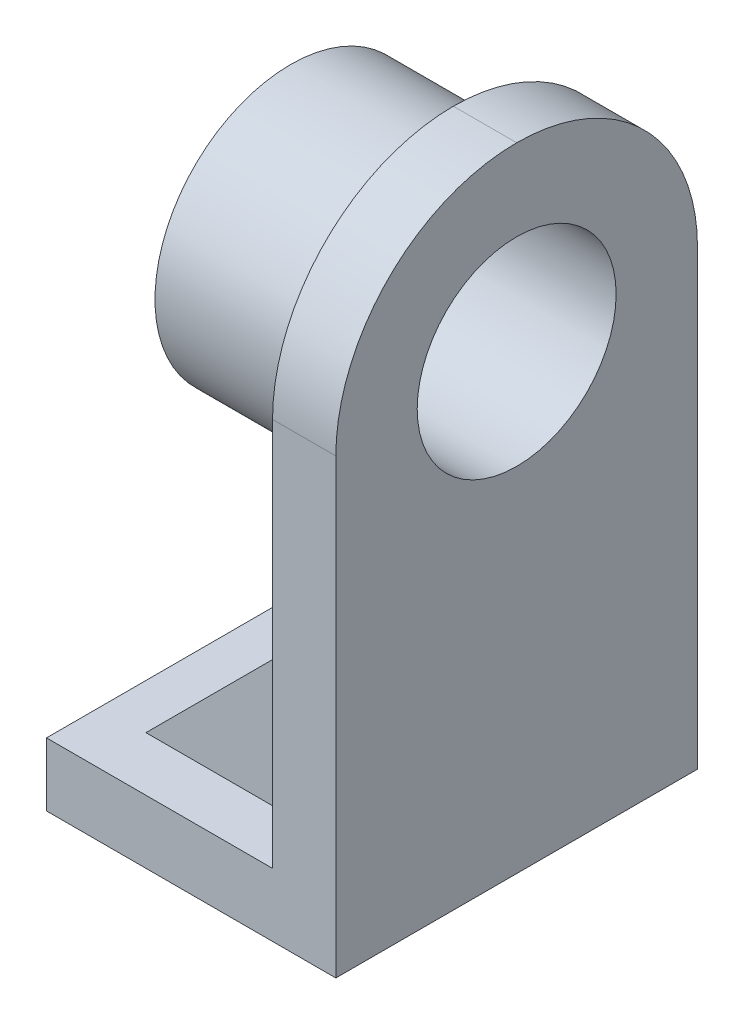
from build123d import *

# Parameters (mm, degrees)
BOSS_EXTRUDE1_DEPTH = 40
FILLET1_R           = 20
BOSS_EXTRUDE2_DEPTH = 10
CUT_EXTRUDE1_DEPTH  = 6
BOSS_EXTRUDE3_DEPTH = 10
CUT_EXTRUDE3_DEPTH  = 6
SKETCH15_R          = 15
SKETCH15_R_2        = 11
BOSS_EXTRUDE4_DEPTH = 18
CUT_EXTRUDE4_START  = -7
SKETCH16_R          = 11
CUT_EXTRUDE4_DEPTH  = 7


with BuildPart() as part:
    # Sketch1 → Boss-Extrude1 (new body)
    with BuildSketch(Plane.XY):
        Polygon((0, 0), (-32, 0), (-32, 7), (-7, 7), (-7, 70), (0, 70), align=None)
    extrude(amount=-BOSS_EXTRUDE1_DEPTH)

    # Fillet1
    fillet1_edges = [part.edges().sort_by_distance(p)[0] for p in [
        (-3.5, 70, 0),
        (-3.5, 70, -40),
    ]]
    fillet(fillet1_edges, radius=FILLET1_R - 0.0001)  # a hair under: the kernel refuses the full size

    # Sketch7 → Boss-Extrude2 (add)
    with BuildSketch(Plane.XY):
        Polygon((-7, 7), (-27, 7), (-7, 27), align=None)
    extrude(amount=-BOSS_EXTRUDE2_DEPTH)

    # Sketch11 → Cut-Extrude1 (cut)
    with BuildSketch(Plane.XY):
        Polygon((-7, 27), (-7, 7), (-27, 7), align=None)
    extrude(amount=-CUT_EXTRUDE1_DEPTH, mode=Mode.SUBTRACT)

    # Sketch12 → Boss-Extrude3 (add)
    with BuildSketch(Plane(origin=(0, 0, -40), x_dir=(-1, 0, 0), z_dir=(0, 0, -1))):
        Polygon((7, 27), (7, 7), (27, 7), align=None)
    extrude(amount=-BOSS_EXTRUDE3_DEPTH)

    # Sketch13 → Cut-Extrude3 (cut)
    with BuildSketch(Plane(origin=(0, 0, -40), x_dir=(-1, 0, 0), z_dir=(0, 0, -1))):
        Polygon((7, 27), (27, 7), (7, 7), align=None)
    extrude(amount=-CUT_EXTRUDE3_DEPTH, mode=Mode.SUBTRACT)

    # Sketch15 → Boss-Extrude4 (add)
    with BuildSketch(Plane.ZY.offset(7)):
        with Locations(Location((-20, 50, 0), (0, 0, 270))):
            Circle(SKETCH15_R)
        with Locations(Location((-20, 50, 0), (0, 0, 270))):
            Circle(SKETCH15_R_2, mode=Mode.SUBTRACT)
    extrude(amount=BOSS_EXTRUDE4_DEPTH)

    # Sketch16 → Cut-Extrude4 (cut)
    with BuildSketch(Plane.ZY.offset(7).offset(CUT_EXTRUDE4_START)):
        with Locations(Location((-20, 50, 0), (0, 0, 270))):
            Circle(SKETCH16_R)
    extrude(amount=CUT_EXTRUDE4_DEPTH, mode=Mode.SUBTRACT)


solid = part.part
